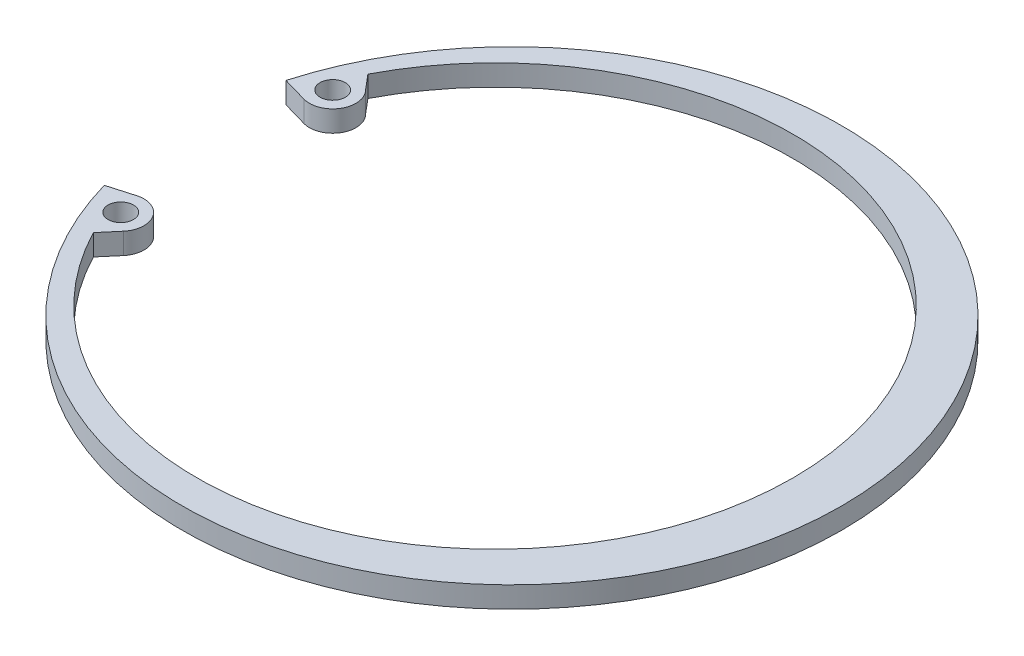
from build123d import *

# Parameters (mm, degrees)
SKETCH2_R          = 1.5
BASE_FLANGE1_DEPTH = 2.5


# Sheet-metal steps are written as plain solids
with BuildPart() as part:
    # Sketch2 → Base-Flange1 (new body)
    with BuildSketch(Plane(origin=(0, 0, 0), x_dir=(1, 0, 0), z_dir=(0, 1, 0))):
        with BuildLine():
            Line((-37.489206142, 10.749856877), (-34.508002728, 9.895010554))
            ThreePointArc((-34.508002728, 9.895010554), (-31.386761745, 11.132206792), (-31.788206612, 14.465619731))
            Line((-31.788206612, 14.465619731), (-33.28565867, 16.240999403))
            ThreePointArc((-33.28565867, 16.240999403), (33.25, 0), (-33.28565867, -16.240999403))
            Line((-33.28565867, -16.240999403), (-31.653444876, -14.318074725))
            ThreePointArc((-31.653444876, -14.318074725), (-31.439414621, -11.047274261), (-34.508002728, -9.895010554))
            Line((-34.508002728, -9.895010554), (-37.489206142, -10.749856877))
            ThreePointArc((-37.489206142, -10.749856877), (39, 0), (-37.489206142, 10.749856877))
        make_face()
        with Locations(Location((-33.75, 12.538480218, 0), (0, 0, 270))):
            Circle(SKETCH2_R, mode=Mode.SUBTRACT)
        with Locations(Location((-33.75, -12.538480218, 0), (0, 0, 90))):
            Circle(SKETCH2_R, mode=Mode.SUBTRACT)
    extrude(amount=-BASE_FLANGE1_DEPTH)


solid = part.part
